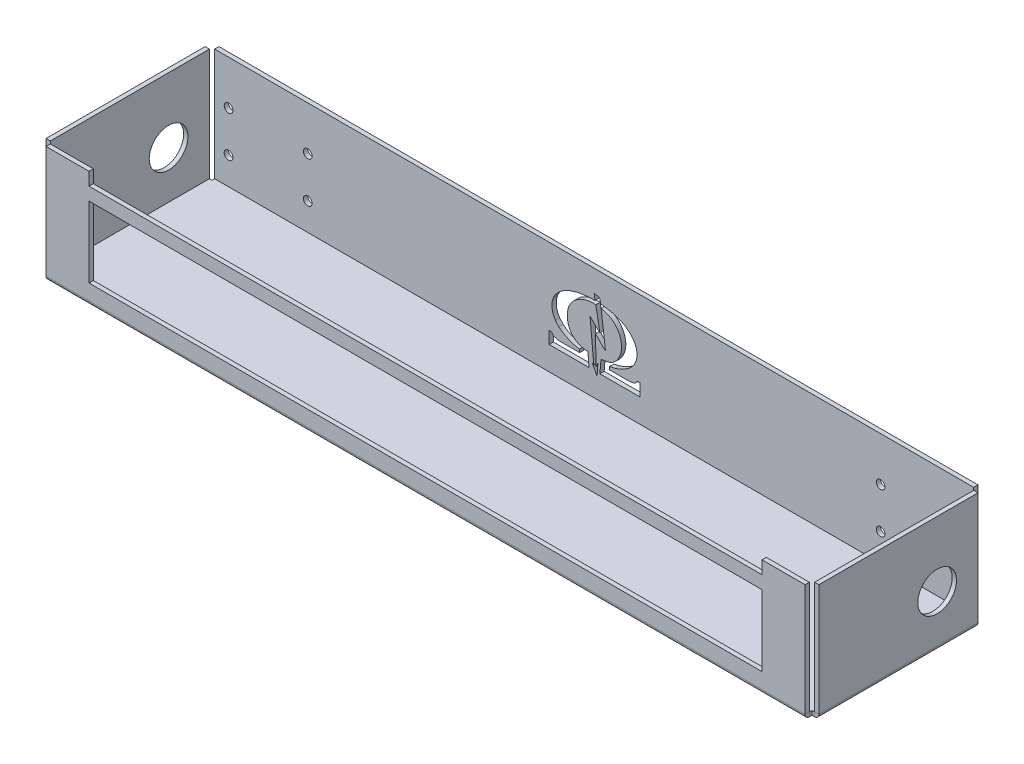
from build123d import *

# Parameters (mm, degrees)
FLANGE_BASE1_DEPTH                             = 2
DOBRA_START                                    = -48.25
DOBRA_ESBO_ADA1_OUTLINE_W                      = 2
DOBRA_ESBO_ADA1_OUTLINE_H                      = 52.214601837
DOBRA_ESBO_ADA1_DEPTH                          = 74
DOBRA_START_2                                  = -176.5
DOBRA_ESBO_ADA1_2_OUTLINE_W                    = 52.214601837
DOBRA_ESBO_ADA1_2_OUTLINE_H                    = 2
DOBRA_ESBO_ADA1_2_DEPTH                        = 353
DOBRA_START_3                                  = -103.25
DOBRA_ESBO_ADA1_3_OUTLINE_W                    = 353
DOBRA_ESBO_ADA1_3_OUTLINE_H                    = 2
DOBRA_ESBO_ADA1_3_DEPTH                        = 51.785398163
DOBRA_START_4                                  = 28.964601837
DOBRA_ESBO_ADA1_4_OUTLINE_W                    = 353
DOBRA_ESBO_ADA1_4_OUTLINE_H                    = 2
DOBRA_ESBO_ADA1_4_DEPTH                        = 51.785398163
DOBRA_ESBO_ADA1_5_DEPTH                        = 74
DOBRA_ESBO_ADA1_6_DEPTH                        = 353
DOBRA_START_5                                  = -231.5
DOBRA_ESBO_ADA1_7_OUTLINE_W                    = 2
DOBRA_ESBO_ADA1_7_OUTLINE_H                    = 74
DOBRA_ESBO_ADA1_7_DEPTH                        = 51.785398163
DOBRA_START_6                                  = 179.714601837
DOBRA_ESBO_ADA1_8_OUTLINE_W                    = 2
DOBRA_ESBO_ADA1_8_OUTLINE_H                    = 74
DOBRA_ESBO_ADA1_8_DEPTH                        = 51.785398163
FURO1_START                                    = -179.714601837
FURO1_OUTLINE_R                                = 9
FURO1_DEPTH                                    = 359.429203674
CORTE_EXTRUS_O1_REACH                          = 205.697
ESBO_O9_W                                      = 313
ESBO_O9_H                                      = 33
ESBO_O9_H_2                                    = 6
BROCA_DE_ROSQUEAR_DE_CANO_PARA_TARRAXA_D_D     = 4.04
BROCA_DE_ROSQUEAR_DE_CANO_PARA_TARRAXA_D_DEPTH = 10
BROCA_DE_ROSQUEAR_DE_CANO_PARA_TARRAXA_D_TIP   = 1.21373845
CORTE_EXTRUS_O2_DEPTH                          = 8


# Read off the part's stored shape, not the designer's step: Dobra esboçada1, Furo1
# Sheet-metal steps are written as plain solids
with BuildPart() as part:
    # Esboço1 → Flange-base1 (new body)
    with BuildSketch(Plane(origin=(0, 0, 0), x_dir=(1, 0, 0), z_dir=(0, 1, 0))):
        Polygon((176.5, 103.25), (176.5, 48.25), (231.5, 48.25), (231.5, -25.75), (176.5, -25.75), (176.5, -80.75), (-176.5, -80.75), (-176.5, -25.75), (-231.5, -25.75), (-231.5, 48.25), (-176.5, 48.25), (-176.5, 103.25), align=None)
    extrude(amount=-FLANGE_BASE1_DEPTH)

    # Dobra esboçada1 outline → Dobra esboçada1 (add)
    with BuildSketch(Plane.XY.offset(DOBRA_START)):
        with Locations((178.714601837, 26.107300919)):
            Rectangle(DOBRA_ESBO_ADA1_OUTLINE_W, DOBRA_ESBO_ADA1_OUTLINE_H)
        with Locations((-178.714601837, 26.107300919)):
            Rectangle(DOBRA_ESBO_ADA1_OUTLINE_W, DOBRA_ESBO_ADA1_OUTLINE_H)
    extrude(amount=DOBRA_ESBO_ADA1_DEPTH)

    # Dobra esbo_ada1 2 outline → Dobra esbo_ada1 2 (add)
    with BuildSketch(Plane.YZ.offset(DOBRA_START_2)):
        with Locations((26.107300919, -50.464601837)):
            Rectangle(DOBRA_ESBO_ADA1_2_OUTLINE_W, DOBRA_ESBO_ADA1_2_OUTLINE_H)
        with Locations((26.107300919, 27.964601837)):
            Rectangle(DOBRA_ESBO_ADA1_2_OUTLINE_W, DOBRA_ESBO_ADA1_2_OUTLINE_H)
    extrude(amount=DOBRA_ESBO_ADA1_2_DEPTH)

    # Dobra esbo_ada1 3 outline → Dobra esbo_ada1 3 (cut)
    with BuildSketch(Plane.XY.offset(DOBRA_START_3)):
        with Locations((0, -1)):
            Rectangle(DOBRA_ESBO_ADA1_3_OUTLINE_W, DOBRA_ESBO_ADA1_3_OUTLINE_H)
    extrude(amount=DOBRA_ESBO_ADA1_3_DEPTH, mode=Mode.SUBTRACT)

    # Dobra esbo_ada1 4 outline → Dobra esbo_ada1 4 (cut)
    with BuildSketch(Plane.XY.offset(DOBRA_START_4)):
        with Locations((0, -1)):
            Rectangle(DOBRA_ESBO_ADA1_4_OUTLINE_W, DOBRA_ESBO_ADA1_4_OUTLINE_H)
    extrude(amount=DOBRA_ESBO_ADA1_4_DEPTH, mode=Mode.SUBTRACT)

    # Dobra esbo_ada1 5 outline → Dobra esbo_ada1 5 (cut)
    with BuildSketch(Plane.XY.offset(DOBRA_START)):
        with BuildLine():
            Line((231.5, 0), (179.714601837, 0))
            ThreePointArc((179.714601837, 0), (179.128815399, -1.414213562), (177.714601837, -2))
            Line((177.714601837, -2), (231.5, -2))
            Line((231.5, -2), (231.5, 0))
        make_face()
        with BuildLine():
            Line((-231.5, -2), (-177.714601837, -2))
            ThreePointArc((-177.714601837, -2), (-179.128815399, -1.414213562), (-179.714601837, 0))
            Line((-179.714601837, 0), (-231.5, 0))
            Line((-231.5, 0), (-231.5, -2))
        make_face()
    extrude(amount=DOBRA_ESBO_ADA1_5_DEPTH, mode=Mode.SUBTRACT)

    # Dobra esbo_ada1 6 outline → Dobra esbo_ada1 6 (cut)
    with BuildSketch(Plane.YZ.offset(DOBRA_START_2)):
        with BuildLine():
            Line((0, -103.25), (0, -51.464601837))
            ThreePointArc((0, -51.464601837), (-1.414213562, -50.878815399), (-2, -49.464601837))
            Line((-2, -49.464601837), (-2, -103.25))
            Line((-2, -103.25), (0, -103.25))
        make_face()
        with BuildLine():
            Line((-2, 80.75), (-2, 26.964601837))
            ThreePointArc((-2, 26.964601837), (-1.414213562, 28.378815399), (0, 28.964601837))
            Line((0, 28.964601837), (0, 80.75))
            Line((0, 80.75), (-2, 80.75))
        make_face()
    extrude(amount=DOBRA_ESBO_ADA1_6_DEPTH, mode=Mode.SUBTRACT)

    # Dobra esbo_ada1 7 outline → Dobra esbo_ada1 7 (cut)
    with BuildSketch(Plane.YZ.offset(DOBRA_START_5)):
        with Locations((-1, -11.25)):
            Rectangle(DOBRA_ESBO_ADA1_7_OUTLINE_W, DOBRA_ESBO_ADA1_7_OUTLINE_H)
    extrude(amount=DOBRA_ESBO_ADA1_7_DEPTH, mode=Mode.SUBTRACT)

    # Dobra esbo_ada1 8 outline → Dobra esbo_ada1 8 (cut)
    with BuildSketch(Plane.YZ.offset(DOBRA_START_6)):
        with Locations((-1, -11.25)):
            Rectangle(DOBRA_ESBO_ADA1_8_OUTLINE_W, DOBRA_ESBO_ADA1_8_OUTLINE_H)
    extrude(amount=DOBRA_ESBO_ADA1_8_DEPTH, mode=Mode.SUBTRACT)

    # Furo1 outline → Furo1 (cut)
    with BuildSketch(Plane.YZ.offset(FURO1_START)):
        with Locations((22, -29.25)):
            Circle(FURO1_OUTLINE_R)
    extrude(amount=FURO1_DEPTH, mode=Mode.SUBTRACT)

    # Esboço9 → Corte-extrusão1 (cut, up to next)
    with BuildSketch(Plane.XY.offset(28.964601837), mode=Mode.PRIVATE) as corte_extrus_o1_sk1:
        with Locations((0, 23.714601837)):
            Rectangle(ESBO_O9_W, ESBO_O9_H)
    corte_extrus_o1_tool1 = extrude(corte_extrus_o1_sk1.sketch, amount=-CORTE_EXTRUS_O1_REACH, mode=Mode.PRIVATE) & part.part
    # Esboço9 → Corte-extrusão1 (cut, up to next)
    with BuildSketch(Plane.XY.offset(28.964601837), mode=Mode.PRIVATE) as corte_extrus_o1_sk2:
        with Locations((0, 49.214601837)):
            Rectangle(ESBO_O9_W, ESBO_O9_H_2)
    corte_extrus_o1_tool2 = extrude(corte_extrus_o1_sk2.sketch, amount=-CORTE_EXTRUS_O1_REACH, mode=Mode.PRIVATE) & part.part
    add(corte_extrus_o1_tool1.solids().sort_by_distance((0, 23.714602, 28.964602))[0], mode=Mode.SUBTRACT)
    add(corte_extrus_o1_tool2.solids().sort_by_distance((0, 49.214602, 28.964602))[0], mode=Mode.SUBTRACT)

    # Broca de rosquear de cano para tarraxa de 1/81
    with Locations(Plane(origin=(0, 0, -51.464601837), x_dir=(-1, 0, 0), z_dir=(0, 0, -1))):
        with Locations((-170.034601837, 31.714601837), (-133.204601837, 31.714601837), (-133.204601837, 12.714601837), (-170.034601837, 12.714601837), (133.204601837, 31.714601837), (133.204601837, 12.714601837), (170.034601837, 12.714601837), (170.034601837, 31.714601837)):
            Hole(BROCA_DE_ROSQUEAR_DE_CANO_PARA_TARRAXA_D_D / 2, depth=BROCA_DE_ROSQUEAR_DE_CANO_PARA_TARRAXA_D_DEPTH)
            with Locations((0, 0, -(BROCA_DE_ROSQUEAR_DE_CANO_PARA_TARRAXA_D_DEPTH + BROCA_DE_ROSQUEAR_DE_CANO_PARA_TARRAXA_D_TIP / 2))):  # 118° drill point
                Cone(0, BROCA_DE_ROSQUEAR_DE_CANO_PARA_TARRAXA_D_D / 2, BROCA_DE_ROSQUEAR_DE_CANO_PARA_TARRAXA_D_TIP, mode=Mode.SUBTRACT)

    # Esboço12 → Corte-extrusão2 (cut)
    with BuildSketch(Plane(origin=(0, 7.850437939, -51.464601837), x_dir=(-1, 0, 0), z_dir=(0, 0, -1))):
        with BuildLine():
            Line((-2.646705655, 3.160945272), (-3.164128855, 9.217791872))
            add(Edge.make_bspline(
                [(-3.164128855, 9.217791872), (-4.311386855, 9.672838072), (-7.731481855, 9.241492472), (-10.158731855, 12.077611072)],
                knots=[0.261904762, 0.261904762, 0.261904762, 0.261904762, 0.285714286, 0.285714286, 0.285714286, 0.285714286], degree=3))
            add(Edge.make_bspline(
                [(-10.158731855, 12.077611072), (-15.373502255, 18.170846472), (-12.396217455, 28.398519872), (-3.212939855, 29.768074072)],
                knots=[0.285714286, 0.285714286, 0.285714286, 0.285714286, 0.30952381, 0.30952381, 0.30952381, 0.30952381], degree=3))
            Line((-3.212939855, 29.768074072), (-5.269279455, 13.776526472))
            add(Edge.make_bspline(
                [(-5.269279455, 13.776526472), (-4.047355255, 14.385959072), (-1.907491655, 17.339490072), (-0.586961255, 18.228196072)],
                knots=[0.333333333, 0.333333333, 0.333333333, 0.333333333, 0.357142857, 0.357142857, 0.357142857, 0.357142857], degree=3))
            Line((-0.586961255, 18.228196072), (-0.9157082, 5.259567806))
            Line((-0.9157082, 5.259567806), (-1.705717355, 6.868932949))
            Line((-1.705717355, 6.868932949), (-1.355146331, 1.499369274))
            Line((-1.355146331, 1.499369274), (1.050242145, 6.153521386))
            Line((1.050242145, 6.153521386), (0.186540145, 5.334670672))
            Line((0.186540145, 5.334670672), (1.913944145, 24.042769872))
            add(Edge.make_bspline(
                [(1.913944145, 24.042769872), (0.740485145, 23.019388072), (-2.190435855, 19.896601272), (-2.648807055, 19.642784072)],
                knots=[0.547619048, 0.547619048, 0.547619048, 0.547619048, 0.571428571, 0.571428571, 0.571428571, 0.571428571], degree=3))
            Line((-2.648807055, 19.642784072), (-0.762627655, 30.027158072))
            add(Edge.make_bspline(
                [(-0.762627655, 30.027158072), (5.758708145, 30.466989072), (11.283900545, 26.658640472), (12.249214545, 21.392452272)],
                knots=[0.595238095, 0.595238095, 0.595238095, 0.595238095, 0.619047619, 0.619047619, 0.619047619, 0.619047619], degree=3))
            add(Edge.make_bspline(
                [(12.249214545, 21.392452272), (13.386923145, 15.185874272), (10.269722345, 9.663687672), (2.933256145, 9.327277472)],
                knots=[0.619047619, 0.619047619, 0.619047619, 0.619047619, 0.642857143, 0.642857143, 0.642857143, 0.642857143], degree=3))
            Line((2.933256145, 9.327277472), (2.374363545, 3.167887872))
            Line((2.374363545, 3.167887872), (20.987394345, 3.159907872))
            Line((20.987394345, 3.159907872), (21.028863745, 8.856563872))
            Line((21.028863745, 8.856563872), (19.721260945, 8.848371072))
            add(Edge.make_bspline(
                [(19.721260945, 8.848371072), (19.077700545, 6.901330872), (16.463612145, 6.968655472), (14.190189945, 6.970570672)],
                knots=[0.738095238, 0.738095238, 0.738095238, 0.738095238, 0.761904762, 0.761904762, 0.761904762, 0.761904762], degree=3))
            add(Edge.make_bspline(
                [(14.190189945, 6.970570672), (11.738494545, 6.972672072), (9.201519545, 6.906331672), (6.760703545, 6.986291272)],
                knots=[0.761904762, 0.761904762, 0.761904762, 0.761904762, 0.785714286, 0.785714286, 0.785714286, 0.785714286], degree=3))
            Line((6.760703545, 6.986291272), (6.829012345, 8.335602872))
            add(Edge.make_bspline(
                [(6.829012345, 8.335602872), (10.435014745, 8.891808872), (14.538703145, 10.663528472), (16.428712945, 12.615755672)],
                knots=[0.80952381, 0.80952381, 0.80952381, 0.80952381, 0.833333333, 0.833333333, 0.833333333, 0.833333333], degree=3))
            add(Edge.make_bspline(
                [(16.428712945, 12.615755672), (17.007316145, 13.213324672), (17.472071345, 13.598253272), (18.036443545, 14.402504272)],
                knots=[0.833333333, 0.833333333, 0.833333333, 0.833333333, 0.857142857, 0.857142857, 0.857142857, 0.857142857], degree=3))
            add(Edge.make_bspline(
                [(18.036443545, 14.402504272), (19.749057945, 16.843213872), (20.106428945, 20.135283072), (19.026149745, 22.922537472)],
                knots=[0.857142857, 0.857142857, 0.857142857, 0.857142857, 0.880952381, 0.880952381, 0.880952381, 0.880952381], degree=3))
            add(Edge.make_bspline(
                [(19.026149745, 22.922537472), (17.889265745, 25.855772672), (14.767729145, 28.243707872), (11.600387345, 29.522529472)],
                knots=[0.880952381, 0.880952381, 0.880952381, 0.880952381, 0.904761905, 0.904761905, 0.904761905, 0.904761905], degree=3))
            add(Edge.make_bspline(
                [(11.600387345, 29.522529472), (7.516515945, 31.171436872), (4.360239745, 31.441081072), (-0.395228455, 31.563760272)],
                knots=[0.904761905, 0.904761905, 0.904761905, 0.904761905, 0.928571429, 0.928571429, 0.928571429, 0.928571429], degree=3))
            Line((-0.395228455, 31.563760272), (-0.008437855, 34.199687272))
            add(Edge.make_bspline(
                [(-0.008437855, 34.199687272), (-2.792314055, 33.808880072), (-2.675939055, 34.186972472), (-2.922122055, 31.499734072)],
                knots=[0.952380952, 0.952380952, 0.952380952, 0.952380952, 1, 1, 1, 1], degree=3))
            add(Edge.make_bspline(
                [(-2.922122055, 31.499734072), (-7.145271055, 31.020535072), (-10.056960255, 30.573176272), (-13.439203455, 28.765972272)],
                knots=[0, 0, 0, 0, 0.023809524, 0.023809524, 0.023809524, 0.023809524], degree=3))
            add(Edge.make_bspline(
                [(-13.439203455, 28.765972272), (-21.692545055, 24.356038072), (-21.405105455, 16.355901872), (-16.292612055, 12.264742072)],
                knots=[0.023809524, 0.023809524, 0.023809524, 0.023809524, 0.047619048, 0.047619048, 0.047619048, 0.047619048], degree=3))
            add(Edge.make_bspline(
                [(-16.292612055, 12.264742072), (-14.297346055, 10.668077072), (-12.293009455, 9.713270072), (-9.761913055, 8.929022272)],
                knots=[0.047619048, 0.047619048, 0.047619048, 0.047619048, 0.071428571, 0.071428571, 0.071428571, 0.071428571], degree=3))
            add(Edge.make_bspline(
                [(-9.761913055, 8.929022272), (-8.931328055, 8.671667272), (-7.740446055, 8.634959272), (-7.073637255, 8.229256072)],
                knots=[0.071428571, 0.071428571, 0.071428571, 0.071428571, 0.095238095, 0.095238095, 0.095238095, 0.095238095], degree=3))
            Line((-7.073637255, 8.229256072), (-7.006312655, 6.971209072))
            add(Edge.make_bspline(
                [(-7.006312655, 6.971209072), (-9.498360255, 6.970969672), (-11.985300655, 6.972618872), (-14.472187855, 6.970517472)],
                knots=[0.119047619, 0.119047619, 0.119047619, 0.119047619, 0.142857143, 0.142857143, 0.142857143, 0.142857143], degree=3))
            add(Edge.make_bspline(
                [(-14.472187855, 6.970517472), (-16.787904055, 6.968602272), (-19.279499455, 6.899575272), (-19.975328855, 8.856563872)],
                knots=[0.142857143, 0.142857143, 0.142857143, 0.142857143, 0.166666667, 0.166666667, 0.166666667, 0.166666667], degree=3))
            Line((-19.975328855, 8.856563872), (-21.262476255, 8.849807472))
            Line((-21.262476255, 8.849807472), (-21.274818655, 3.170148872))
            Line((-21.274818655, 3.170148872), (-2.646705655, 3.160945272))
        make_face()
    extrude(amount=-CORTE_EXTRUS_O2_DEPTH, mode=Mode.SUBTRACT)


solid = part.part
